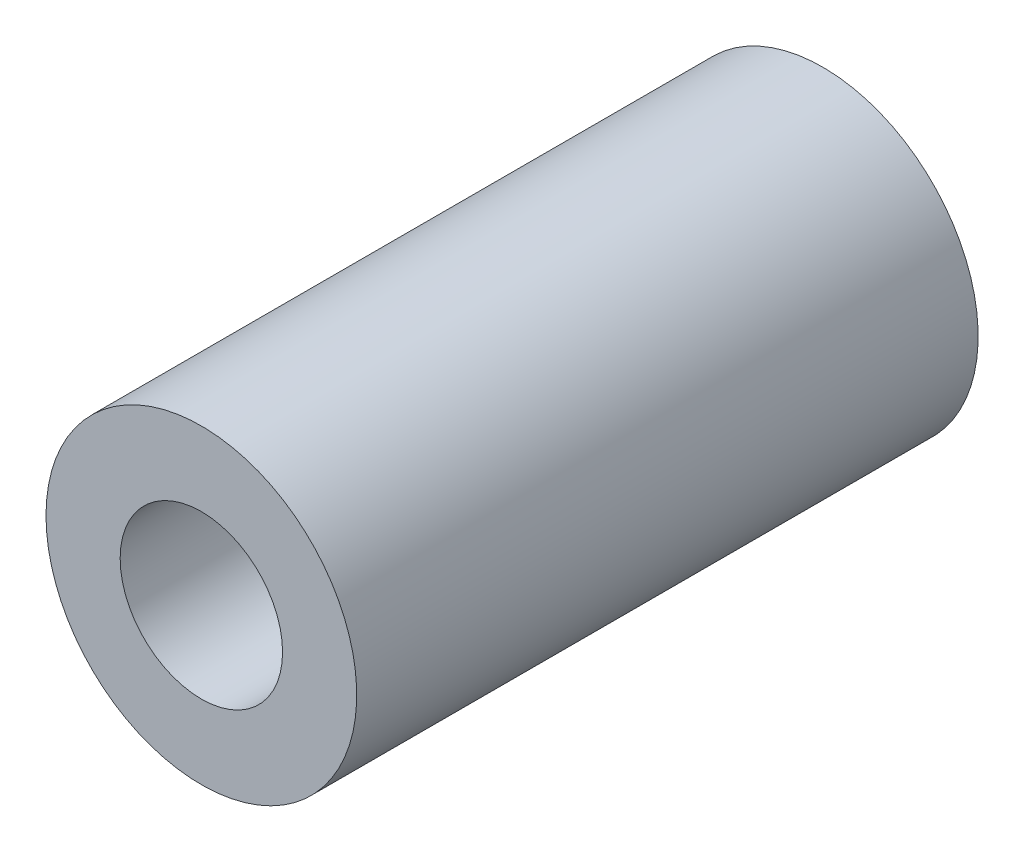
from build123d import *

# Parameters (mm, degrees)
SKETCH1_R           = 4.7625
SKETCH1_R_2         = 2.4892
BOSS_EXTRUDE1_DEPTH = 19.05


with BuildPart() as part:
    # Sketch1 → Boss-Extrude1 (new body)
    with BuildSketch(Plane.XY):
        Circle(SKETCH1_R)
        Circle(SKETCH1_R_2, mode=Mode.SUBTRACT)
    extrude(amount=BOSS_EXTRUDE1_DEPTH)


solid = part.part
